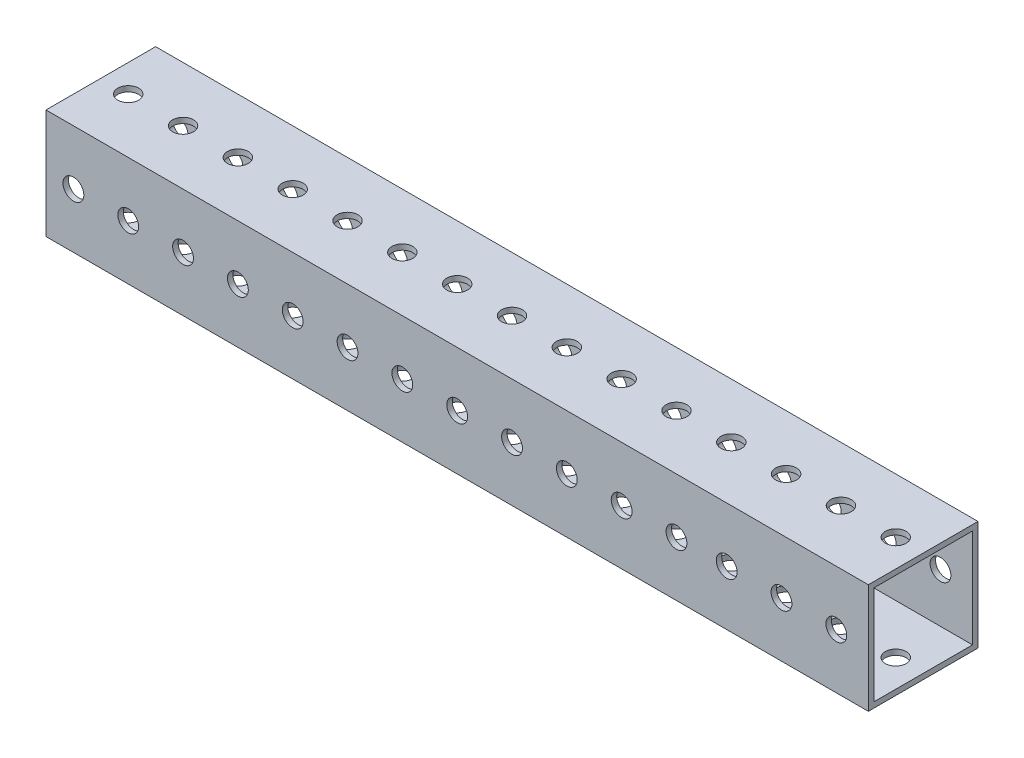
from build123d import *

# Parameters (mm, degrees)
SKETCH1_W           = 190.5
SKETCH1_H           = 25.4
BOSS_EXTRUDE1_DEPTH = 25.4
SKETCH2_W           = 22.86
SKETCH2_H           = 22.86
CUT_EXTRUDE1_DEPTH  = 194.857086535
SKETCH3_R           = 2.413
CUT_EXTRUDE2_DEPTH  = 194.857086535
SKETCH4_R           = 2.413
CUT_EXTRUDE3_DEPTH  = 194.857086535


with BuildPart() as part:
    # Sketch1 → Boss-Extrude1 (new body)
    with BuildSketch(Plane(origin=(0, 0, 0), x_dir=(1, 0, 0), z_dir=(0, 1, 0))):
        with Locations((95.25, 12.7)):
            Rectangle(SKETCH1_W, SKETCH1_H)
    extrude(amount=BOSS_EXTRUDE1_DEPTH)

    # Sketch2 → Cut-Extrude1 (cut, through all)
    with BuildSketch(Plane.ZY):
        with Locations((-12.7, 12.7)):
            Rectangle(SKETCH2_W, SKETCH2_H)
    extrude(amount=-CUT_EXTRUDE1_DEPTH, mode=Mode.SUBTRACT)

    # Sketch3 → Cut-Extrude2 (cut, through all)
    with BuildSketch(Plane(origin=(0, 25.4, 0), x_dir=(1, 0, 0), z_dir=(0, 1, 0))):
        with Locations((6.35, 12.7)):
            Circle(SKETCH3_R)
        with Locations((19.05, 12.7)):
            Circle(SKETCH3_R)
        with Locations((31.75, 12.7)):
            Circle(SKETCH3_R)
        with Locations((44.45, 12.7)):
            Circle(SKETCH3_R)
        with Locations((57.15, 12.7)):
            Circle(SKETCH3_R)
        with Locations((69.85, 12.7)):
            Circle(SKETCH3_R)
        with Locations((82.55, 12.7)):
            Circle(SKETCH3_R)
        with Locations((95.25, 12.7)):
            Circle(SKETCH3_R)
        with Locations((107.95, 12.7)):
            Circle(SKETCH3_R)
        with Locations((120.65, 12.7)):
            Circle(SKETCH3_R)
        with Locations((133.35, 12.7)):
            Circle(SKETCH3_R)
        with Locations((146.05, 12.7)):
            Circle(SKETCH3_R)
        with Locations((158.75, 12.7)):
            Circle(SKETCH3_R)
        with Locations((171.45, 12.7)):
            Circle(SKETCH3_R)
        with Locations((184.15, 12.7)):
            Circle(SKETCH3_R)
        with Locations((196.85, 12.7)):
            Circle(SKETCH3_R)
    extrude(amount=-CUT_EXTRUDE2_DEPTH, mode=Mode.SUBTRACT)

    # Sketch4 → Cut-Extrude3 (cut, through all)
    with BuildSketch(Plane(origin=(0, 0, -25.4), x_dir=(-1, 0, 0), z_dir=(0, 0, -1))):
        with Locations((-6.35, 12.7)):
            Circle(SKETCH4_R)
        with Locations((-19.05, 12.7)):
            Circle(SKETCH4_R)
        with Locations((-31.75, 12.7)):
            Circle(SKETCH4_R)
        with Locations((-44.45, 12.7)):
            Circle(SKETCH4_R)
        with Locations((-57.15, 12.7)):
            Circle(SKETCH4_R)
        with Locations((-69.85, 12.7)):
            Circle(SKETCH4_R)
        with Locations((-82.55, 12.7)):
            Circle(SKETCH4_R)
        with Locations((-95.25, 12.7)):
            Circle(SKETCH4_R)
        with Locations((-107.95, 12.7)):
            Circle(SKETCH4_R)
        with Locations((-120.65, 12.7)):
            Circle(SKETCH4_R)
        with Locations((-133.35, 12.7)):
            Circle(SKETCH4_R)
        with Locations((-146.05, 12.7)):
            Circle(SKETCH4_R)
        with Locations((-157.67812, 12.7)):
            Circle(SKETCH4_R)
        with Locations((-170.37812, 12.7)):
            Circle(SKETCH4_R)
        with Locations((-183.07812, 12.7)):
            Circle(SKETCH4_R)
        with Locations((-196.85, 12.7)):
            Circle(SKETCH4_R)
    extrude(amount=-CUT_EXTRUDE3_DEPTH, mode=Mode.SUBTRACT)


solid = part.part
